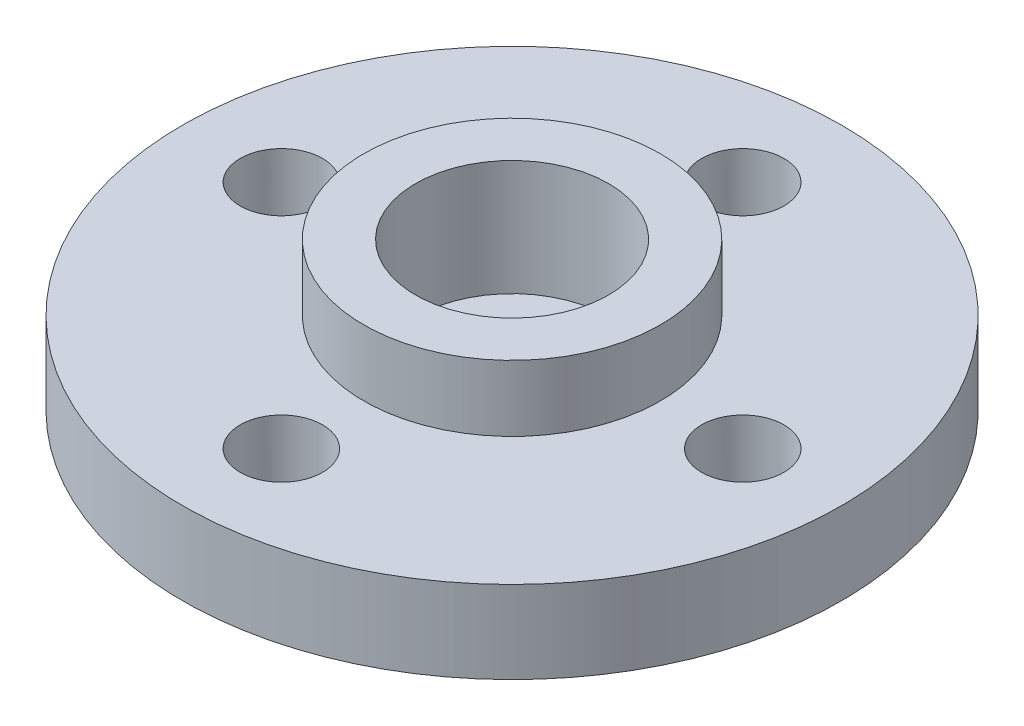
from build123d import *

# Parameters (mm, degrees)
M3_TAPPED_HOLE1_D = 2.5
CIRPATTERN1_COUNT = 4


with BuildPart() as part:
    # Sketch1 → Revolve1 (revolve)
    with BuildSketch(Plane(origin=(0, 0, 0), x_dir=(0, 0, -1), z_dir=(1, 0, 0))):
        Polygon((1.6, 0), (1.6, 1), (2.93, 1), (2.93, 4.5), (4.5, 4.5), (4.5, 2.5), (10, 2.5), (10, 0), align=None)
    revolve(axis=Axis((0, 0, 0), (0, 1, 0)))

    # M3 Tapped Hole1 (through all)
    with Locations(Plane(origin=(0, 0, 0), x_dir=(-1, 0, 0), z_dir=(0, -1, 0))):
        with Locations((0, -7)):
            m3_tapped_hole1 = Hole(M3_TAPPED_HOLE1_D / 2)

    # CirPattern1: M3 Tapped Hole1 ×4 about axis
    cirpattern1_axis = Axis((0, 0, 0), (0, -1, 0))
    for i in range(1, CIRPATTERN1_COUNT):
        add(m3_tapped_hole1.rotate(cirpattern1_axis, i * 360 / CIRPATTERN1_COUNT), mode=Mode.SUBTRACT)


solid = part.part
